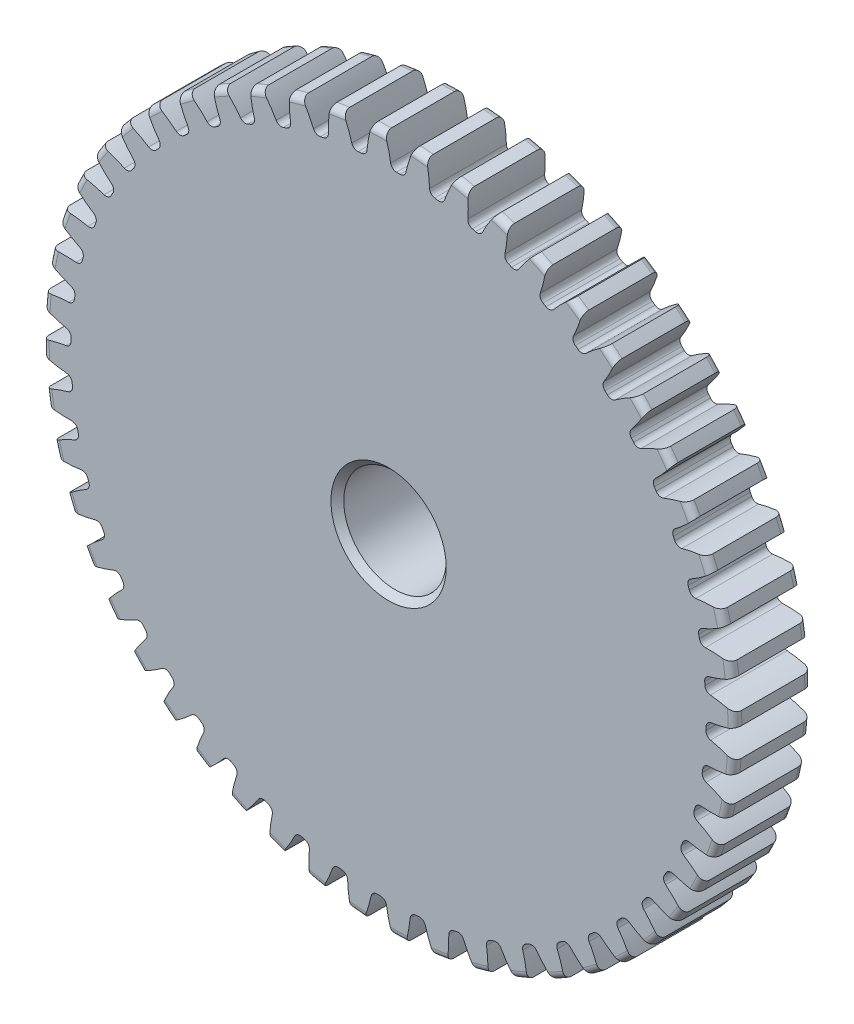
from build123d import *
from OCP.BRepAlgoAPI import BRepAlgoAPI_Cut
from OCP.TopTools import TopTools_ListOfShape

# Parameters (mm, degrees)
SKETCH1_R           = 21.463
BOSS_EXTRUDE1_DEPTH = 4.7625
FILLET2_R           = 0.4292599999999999
CUT_EXTRUDE1_DEPTH  = 33.323496075495925
FILLET1_R           = 0.37404675
CIRPATTERN1_START   = -6
CIRPATTERN1_DEPTH   = 7
SKETCH5_R           = 3.175
CUT_EXTRUDE2_DEPTH  = 33.32153128793448
CHAMFER1_SIZE       = 0.396875


with BuildPart() as part:
    # Sketch1 → Boss-Extrude1 (new body)
    with BuildSketch(Plane.XY):
        Circle(SKETCH1_R)
    extrude(amount=-BOSS_EXTRUDE1_DEPTH)

    # Sketch2 → Revolve1 (revolve)
    with BuildSketch(Plane(origin=(0, 0, 0), x_dir=(0, 0, -1), z_dir=(1, 0, 0)), mode=Mode.PRIVATE) as revolve1_sk:
        Polygon((4.7625, 0), (11.112499999999999, 0), (11.1125, 7.9375), (4.7625, 7.9375), align=None)
    revolve(revolve1_sk.sketch.rotate(Axis((0, 0, -4.7625), (0, 0, -1)), 90), axis=Axis((0, 0, -4.7625), (0, 0, -1)))

    # Fillet2
    fillet2_edges = [part.edges().sort_by_distance(p)[0] for p in [
        (-21.463, 1.216e-14, 0),
        (-21.463, 1.216e-14, -4.7625),
        (-7.9375, -1.85e-15, -4.7625),
    ]]
    fillet(fillet2_edges, radius=FILLET2_R)

    # Sketch4 → Cut-Extrude1 (cut, through all)
    with BuildSketch(Plane.XY):
        with BuildLine():
            Line((0.12990537501521288, 19.979724619476762), (0.1299053750152129, 19.676633686239324))
            ThreePointArc((0.1299053750152129, 19.676633686239324), (0.594308255052561, 19.668085476906043), (1.0583799824959919, 19.648578076836955))
            Line((1.0583799824959919, 19.648578076836955), (1.076680200368878, 19.951116034515902))
            add(Edge.make_bspline(
                [(3.5053262041691093, 24.1009305435634), (1.5855896955468263, 22.317663113100682), (1.076680200368878, 19.951116034515902)],
                knots=[0, 0, 0, 1, 1, 1], degree=2))
            ThreePointArc((3.5053262041691093, 24.1009305435634), (0.7355816668546032, 24.343399197209276), (-2.0437495252820064, 24.268606320537067))
            add(Edge.make_bspline(
                [(-2.0437495252820064, 24.268606320537067), (-0.23518674762945802, 22.372681303460688), (0.12990537501521288, 19.979724619476762)],
                knots=[0, 0, 0, 1, 1, 1], degree=2))
        make_face()
    extrude(amount=-CUT_EXTRUDE1_DEPTH, mode=Mode.SUBTRACT)

    # Fillet1
    # the kernel refuses this fillet: 0.37404675 mm, written as the material it adds along each edge
    with BuildSketch(Plane(origin=(1.0583799824959916, 19.648578076836955, 0), x_dir=(0.06037863844127482, 0.9981755456932301, 0), z_dir=(0, 0, -1))) as fillet1_piece_1:
        with BuildLine():
            CenterArc((0.3682846750210924, -0.3683215269541162), FILLET1_R, 100.0375195144979, 78.53865716127846)
            Line((-0.005646586015991, -0.35902727040611954), (-0.01312521123673288, -0.3588413852751596))
            ThreePointArc((-0.01312521123673288, -0.3588413852751596), (-0.00948433414538891, -0.1794088739639045), (-0.00748077197120016, 4.938814757435e-05))
            Line((-0.00748077197120016, 4.938814757435e-05), (-3.45e-15, 0.00748093500000005))
            ThreePointArc((-3.45e-15, 0.00748093500000005), (0.15154546661873697, 0.00748093500005724), (0.3017870584017921, 0.00736643053908231))
            Line((0.3017870584017921, 0.00736643053908231), (0.3030909332374632, 0))
        make_face()
    extrude(amount=4.7625)
    with BuildSketch(Plane(origin=(0.12990537501521293, 19.676633686239327, 0), x_dir=(3.7234e-13, 1, 0), z_dir=(0, 0, -1))) as fillet1_piece_2:
        with BuildLine():
            CenterArc((0.36828467502108214, 0.3683215269541169), FILLET1_R, 181.42382332422375, 78.53865716127888)
            Line((-0.0056465860160002, 0.35902727040611954), (-0.01312521123674199, 0.3588413852751596))
            ThreePointArc((-0.01312521123674199, 0.3588413852751596), (-0.00948433414539521, 0.17940887396390423), (-0.00748077197119914, -4.938814757451e-05))
            Line((-0.00748077197119914, -4.938814757451e-05), (-2.79e-15, -0.00748093499999999))
            ThreePointArc((-2.79e-15, -0.00748093499999999), (0.15154546661872537, -0.00748093500005648), (0.30178705840178294, -0.00736643053908234))
            Line((0.30178705840178294, -0.00736643053908234), (0.3030909332374563, 0))
        make_face()
    extrude(amount=4.7625)


with BuildPart() as cirpattern1_tool:
    # CirPattern1: read off the stored shape, not the designer's step
    # CirPattern1 outline → CirPattern1 (new body)
    with BuildSketch(Plane.XY.offset(CIRPATTERN1_START)):
        with BuildLine():
            ThreePointArc((-1.675742488, 19.605577669), (-1.447036982, 19.709901289), (-1.336011305, 19.935429393))
            add(Edge.make_bspline(
                [(-1.336011305, 19.935429393), (-1.265570128742731, 20.70748280821275), (-1.044260141, 21.437587002)],
                knots=[0, 0, 0, 0.3202697880965031, 0.3202697880965031, 0.3202697880965031], degree=2))
            ThreePointArc((-1.044260141, 21.437587002), (-1.942375862, 21.374927954), (-2.837074228, 21.274665188))
            add(Edge.make_bspline(
                [(-2.837074228, 21.274665188), (-2.4877852145535964, 20.596418055803802), (-2.279331459, 19.849708294)],
                knots=[0.6797302119034978, 0.6797302119034978, 0.6797302119034978, 1, 1, 1], degree=2))
            ThreePointArc((-2.279331459, 19.849708294), (-2.129471844, 19.647887279), (-1.885707706, 19.586497775))
            ThreePointArc((-1.885707706, 19.586497775), (-1.780750651, 19.596318934), (-1.675742488, 19.605577669))
        make_face()
        with BuildLine():
            add(Edge.make_bspline(
                [(3.473671284, 19.675870479), (3.7268300430887593, 20.40863174818746), (4.116434535, 21.064557495)],
                knots=[0, 0, 0, 0.32026978809651097, 0.32026978809651097, 0.32026978809651097], degree=2))
            ThreePointArc((4.116434535, 21.064557495), (3.229421133, 21.218652363), (2.336726625, 21.335418385))
            add(Edge.make_bspline(
                [(2.336726625, 21.335418385), (2.5135507713843275, 20.593289550794587), (2.537247897, 19.818391569)],
                knots=[0.6797302119035005, 0.6797302119035005, 0.6797302119035005, 1, 1, 1], degree=2))
            ThreePointArc((2.537247897, 19.818391569), (2.634453932, 19.586571352), (2.856443258, 19.468629139))
            ThreePointArc((2.856443258, 19.468629139), (2.960700809, 19.453047045), (3.064873386, 19.436906641))
            ThreePointArc((3.064873386, 19.436906641), (3.311899403, 19.483465995), (3.473671284, 19.675870479))
        make_face()
        with BuildLine():
            add(Edge.make_bspline(
                [(5.820008418, 19.113706425), (6.159645975509347, 19.810610123355232), (6.625472924, 20.414791801)],
                knots=[0, 0, 0, 0.32026978809650025, 0.32026978809650025, 0.32026978809650025], degree=2))
            ThreePointArc((6.625472924, 20.414791801), (5.763500932, 20.674680794), (4.891389761, 20.898197892))
            add(Edge.make_bspline(
                [(4.891389761, 20.898197892), (4.977470914238654, 20.140166218308664), (4.907591631, 19.368061743)],
                knots=[0.679730211903499, 0.679730211903499, 0.679730211903499, 1, 1, 1], degree=2))
            ThreePointArc((4.907591631, 19.368061743), (4.976146085, 19.126214863), (5.182300496, 18.982374725))
            ThreePointArc((5.182300496, 18.982374725), (5.283919678, 18.954339383), (5.38538721, 18.925760044))
            ThreePointArc((5.38538721, 18.925760044), (5.636224239, 18.942204232), (5.820008418, 19.113706425))
        make_face()
        with BuildLine():
            add(Edge.make_bspline(
                [(8.081476723, 18.272821491), (8.502640399292238, 18.92370519331555), (9.037896999, 19.467332472)],
                knots=[0, 0, 0, 0.32026978809650697, 0.32026978809650697, 0.32026978809650697], degree=2))
            ThreePointArc((9.037896999, 19.467332472), (8.213535909, 19.829225824), (7.374725419, 20.156234616))
            add(Edge.make_bspline(
                [(7.374725419, 20.156234616), (7.368808322875012, 19.393353910655094), (7.206371627, 18.635301963)],
                knots=[0.6797302119034843, 0.6797302119034843, 0.6797302119034843, 1, 1, 1], degree=2))
            ThreePointArc((7.206371627, 18.635301963), (7.245274823, 18.386955093), (7.432588124, 18.219314543))
            ThreePointArc((7.432588124, 18.219314543), (7.530087101, 18.179234772), (7.62736996, 18.138633248))
            ThreePointArc((7.62736996, 18.138633248), (7.878360232, 18.124722478), (8.081476723, 18.272821491))
        make_face()
        with BuildLine():
            add(Edge.make_bspline(
                [(10.2250989, 17.165477673), (10.721647179774678, 17.76085002908428), (11.318528183, 18.235995599)],
                knots=[0, 0, 0, 0.3202697880965031, 0.3202697880965031, 0.3202697880965031], degree=2))
            ThreePointArc((11.318528183, 18.235995599), (10.543799037, 18.69461609), (9.750520974, 19.120348052))
            add(Edge.make_bspline(
                [(9.750520974, 19.120348052), (9.652691913052553, 18.363742832954337), (9.400066499, 17.630797517)],
                knots=[0.6797302119035021, 0.6797302119035021, 0.6797302119035021, 1, 1, 1], degree=2))
            ThreePointArc((9.400066499, 17.630797517), (9.408751139, 17.379572114), (9.574491879, 17.190575729))
            ThreePointArc((9.574491879, 17.190575729), (9.666448896, 17.139035981), (9.758128482, 17.087004336))
            ThreePointArc((9.758128482, 17.087004336), (10.005611994, 17.042941456), (10.2250989, 17.165477673))
        make_face()
        with BuildLine():
            add(Edge.make_bspline(
                [(12.219616111, 15.807822538), (12.784308201329196, 16.339001677477754), (13.43410974, 16.738736847)],
                knots=[0, 0, 0, 0.3202697880965035, 0.3202697880965035, 0.3202697880965035], degree=2))
            ThreePointArc((13.43410974, 16.738736847), (12.720309832, 17.287396757), (11.984131977, 17.805643757))
            add(Edge.make_bspline(
                [(11.984131977, 17.805643757), (11.795817519168615, 17.066347033201566), (11.456687233, 16.369196343)],
                knots=[0.6797302119035071, 0.6797302119035071, 0.6797302119035071, 1, 1, 1], degree=2))
            ThreePointArc((11.456687233, 16.369196343), (11.435026677, 16.118755837), (11.576777984, 15.91115961))
            ThreePointArc((11.576777984, 15.91115961), (11.6618521, 15.848911452), (11.746591517, 15.786208423))
            ThreePointArc((11.746591517, 15.786208423), (11.986959403, 15.71263597), (12.219616111, 15.807822538))
        make_face()
        with BuildLine():
            add(Edge.make_bspline(
                [(14.035943802, 14.219653753), (14.660545221553349, 14.678893889186005), (15.353791726, 14.997389619)],
                knots=[0, 0, 0, 0.32026978809650325, 0.32026978809650325, 0.32026978809650325], degree=2))
            ThreePointArc((15.353791726, 14.997389619), (14.711329867, 15.628088251), (14.04298735, 16.231293082))
            add(Edge.make_bspline(
                [(14.04298735, 16.231293082), (13.76693354398736, 15.52008546363799), (13.34624367, 14.868895426)],
                knots=[0.6797302119035039, 0.6797302119035039, 0.6797302119035039, 1, 1, 1], degree=2))
            ThreePointArc((13.34624367, 14.868895426), (13.294553776, 14.622891805), (13.410248596, 14.399722956))
            ThreePointArc((13.410248596, 14.399722956), (13.487199241, 14.327674106), (13.563762796, 14.255214044))
            ThreePointArc((13.563762796, 14.255214044), (13.79350995, 14.15320487), (14.035943802, 14.219653753))
        make_face()
        with BuildLine():
            add(Edge.make_bspline(
                [(15.647595826, 12.424130397), (16.32299847977445, 12.804734773999566), (17.049580854, 13.037346679)],
                knots=[0, 0, 0, 0.32026978809651946, 0.32026978809651946, 0.32026978809651946], degree=2))
            ThreePointArc((17.049580854, 13.037346679), (16.487825585, 13.740887027), (15.897064346, 14.420253604))
            add(Edge.make_bspline(
                [(15.897064346, 14.420253604), (15.537296677300244, 13.747506099825777), (15.041181821, 13.151772531)],
                knots=[0.6797302119034971, 0.6797302119034971, 0.6797302119034971, 1, 1, 1], degree=2))
            ThreePointArc((15.041181821, 13.151772531), (14.960216345, 12.913793082), (15.048167587, 12.678305916))
            ThreePointArc((15.048167587, 12.678305916), (15.115872645, 12.597507007), (15.183143871, 12.516346545))
            ThreePointArc((15.183143871, 12.516346545), (15.398920062, 12.387388173), (15.647595826, 12.424130397))
        make_face()
        with BuildLine():
            add(Edge.make_bspline(
                [(17.031070668, 10.447435244), (17.747425663968958, 10.743853792056584), (18.496748702, 10.887189867)],
                knots=[0, 0, 0, 0.3202697880964952, 0.3202697880964952, 0.3202697880964952], degree=2))
            ThreePointArc((18.496748702, 10.887189867), (18.023891678, 11.653312729), (17.519326345, 12.398934357))
            add(Edge.make_bspline(
                [(17.519326345, 12.398934357), (17.081091038112945, 11.774457140390318), (16.516785671, 11.242867178)],
                knots=[0.6797302119035021, 0.6797302119035021, 0.6797302119035021, 1, 1, 1], degree=2))
            ThreePointArc((16.516785671, 11.242867178), (16.407725271, 11.016382177), (16.466650409, 10.772010626))
            ThreePointArc((16.466650409, 10.772010626), (16.524122589, 10.68363989), (16.581120519, 10.594962528))
            ThreePointArc((16.581120519, 10.594962528), (16.779779245, 10.440935462), (17.031070668, 10.447435244))
        make_face()
        with BuildLine():
            add(Edge.make_bspline(
                [(18.166194149, 8.318392958), (18.91305541826059, 8.526303228773687), (19.674192302, 8.578273311)],
                knots=[0, 0, 0, 0.3202697880965082, 0.3202697880965082, 0.3202697880965082], degree=2))
            ThreePointArc((19.674192302, 8.578273311), (19.297128845, 9.395806891), (18.886117117, 10.196810728))
            add(Edge.make_bspline(
                [(18.886117117, 10.196810728), (18.375804628322744, 9.629710082079612), (17.751537593, 9.170015505)],
                knots=[0.6797302119034963, 0.6797302119034963, 0.6797302119034963, 1, 1, 1], degree=2))
            ThreePointArc((17.751537593, 9.170015505), (17.615972617, 8.958327612), (17.645012388, 8.708635165))
            ThreePointArc((17.645012388, 8.708635165), (17.691413616, 8.613981245), (17.737307092, 8.5190801))
            ThreePointArc((17.737307092, 8.5190801), (17.915951462, 8.342230402), (18.166194149, 8.318392958))
        make_face()
        with BuildLine():
            add(Edge.make_bspline(
                [(19.036413613, 6.068049772), (19.802890236062225, 6.184419964852429), (20.564741876, 6.144266213)],
                knots=[0, 0, 0, 0.32026978809650397, 0.32026978809650397, 0.32026978809650397], degree=2))
            ThreePointArc((20.564741876, 6.144266213), (20.288970419, 7.00128903), (19.977505773, 7.845994637))
            add(Edge.make_bspline(
                [(19.977505773, 7.845994637), (19.402557608343145, 7.3445401665535), (18.727432124, 6.963444356)],
                knots=[0.6797302119034935, 0.6797302119034935, 0.6797302119034935, 1, 1, 1], degree=2))
            ThreePointArc((18.727432124, 6.963444356), (18.567339414, 6.769640459), (18.566070354, 6.518268194))
            ThreePointArc((18.566070354, 6.518268194), (18.600723995, 6.418711357), (18.634843787, 6.318970301))
            ThreePointArc((18.634843787, 6.318970301), (18.790868762, 6.121876837), (19.036413613, 6.068049772))
        make_face()
        with BuildLine():
            add(Edge.make_bspline(
                [(19.6290393, 3.729220757), (20.403954321996714, 3.7523539317426877), (21.155411206, 3.620661879)],
                knots=[0, 0, 0, 0.3202697880965103, 0.3202697880965103, 0.3202697880965103], degree=2))
            ThreePointArc((21.155411206, 3.620661879), (20.984953119, 4.50467661), (20.77757741, 5.380766276))
            add(Edge.make_bspline(
                [(20.77757741, 5.380766276), (20.1463776076792, 4.95227031693491), (19.430238525, 4.655330509)],
                knots=[0.6797302119034873, 0.6797302119034873, 0.6797302119034873, 1, 1, 1], degree=2))
            ThreePointArc((19.430238525, 4.655330509), (19.247952592, 4.482236704), (19.216393206, 4.232850194))
            ThreePointArc((19.216393206, 4.232850194), (19.238793933, 4.129842204), (19.260642497, 4.026715686))
            ThreePointArc((19.260642497, 4.026715686), (19.391772883, 3.812252522), (19.6290393, 3.729220757))
        make_face()
        with BuildLine():
            add(Edge.make_bspline(
                [(19.935429393, 1.336011305), (20.707482808212745, 1.2655701287429508), (21.437587002, 1.044260141)],
                knots=[0, 0, 0, 0.3202697880965029, 0.3202697880965029, 0.3202697880965029], degree=2))
            ThreePointArc((21.437587002, 1.044260141), (21.374927948, 1.942375862), (21.274665181, 2.837074227))
            add(Edge.make_bspline(
                [(21.274665181, 2.837074227), (20.596418055803795, 2.487785214553814), (19.849708294, 2.279331459)],
                knots=[0.6797302119035008, 0.6797302119035008, 0.6797302119035008, 1, 1, 1], degree=2))
            ThreePointArc((19.849708294, 2.279331459), (19.647887279, 2.129471844), (19.586497775, 1.885707706))
            ThreePointArc((19.586497775, 1.885707706), (19.596318934, 1.780750651), (19.605577669, 1.675742488))
            ThreePointArc((19.605577669, 1.675742488), (19.709901289, 1.447036982), (19.935429393, 1.336011305))
        make_face()
        with BuildLine():
            add(Edge.make_bspline(
                [(19.951116035, -1.0766802), (20.709049565894638, -1.2396685365495985), (21.407154507, -1.547369261)],
                knots=[0, 0, 0, 0.32026978809649875, 0.32026978809649875, 0.32026978809649875], degree=2))
            ThreePointArc((21.407154507, -1.547369261), (21.453208195, -0.648249101), (21.461520428, 0.252011247))
            add(Edge.make_bspline(
                [(21.461520428, 0.252011247), (20.7461163495804, -0.0129773982598896), (19.979724619, -0.129905375)],
                knots=[0.6797302119035104, 0.6797302119035104, 0.6797302119035104, 1, 1, 1], degree=2))
            ThreePointArc((19.979724619, -0.129905375), (19.761311526, -0.254345509), (19.6709871, -0.488932645))
            ThreePointArc((19.6709871, -0.488932645), (19.668085477, -0.594308255), (19.664619371, -0.699666808))
            ThreePointArc((19.664619371, -0.699666808), (19.740614951, -0.939279617), (19.951116035, -1.0766802))
        make_face()
        with BuildLine():
            add(Edge.make_bspline(
                [(19.675870479, -3.473671284), (20.4086317481874, -3.726830043088835), (21.064557495, -4.116434535)],
                knots=[0, 0, 0, 0.32026978809651363, 0.32026978809651363, 0.32026978809651363], degree=2))
            ThreePointArc((21.064557495, -4.116434535), (21.218652358, -3.229421132), (21.33541838, -2.336726624))
            add(Edge.make_bspline(
                [(21.33541838, -2.336726624), (20.593289550794587, -2.513550771384401), (19.818391569, -2.537247897)],
                knots=[0.6797302119034996, 0.6797302119034996, 0.6797302119034996, 1, 1, 1], degree=2))
            ThreePointArc((19.818391569, -2.537247897), (19.586571352, -2.634453932), (19.468629139, -2.856443258))
            ThreePointArc((19.468629139, -2.856443258), (19.453047045, -2.960700809), (19.436906641, -3.064873386))
            ThreePointArc((19.436906641, -3.064873386), (19.483465995, -3.311899403), (19.675870479, -3.473671284))
        make_face()
        with BuildLine():
            add(Edge.make_bspline(
                [(19.113706425, -5.820008418), (19.810610123355175, -6.159645975509417), (20.414791801, -6.625472924)],
                knots=[0, 0, 0, 0.3202697880965059, 0.3202697880965059, 0.3202697880965059], degree=2))
            ThreePointArc((20.414791801, -6.625472924), (20.67468079, -5.763500931), (20.898197888, -4.89138976))
            add(Edge.make_bspline(
                [(20.898197888, -4.89138976), (20.140166218308647, -4.977470914238726), (19.368061743, -4.907591631)],
                knots=[0.6797302119035046, 0.6797302119035046, 0.6797302119035046, 1, 1, 1], degree=2))
            ThreePointArc((19.368061743, -4.907591631), (19.126214863, -4.976146085), (18.982374725, -5.182300496))
            ThreePointArc((18.982374725, -5.182300496), (18.954339383, -5.283919678), (18.925760044, -5.38538721))
            ThreePointArc((18.925760044, -5.38538721), (18.942204232, -5.636224239), (19.113706425, -5.820008418))
        make_face()
        with BuildLine():
            add(Edge.make_bspline(
                [(18.272821491, -8.081476723), (18.92370519331547, -8.502640399292302), (19.467332472, -9.037896999)],
                knots=[0, 0, 0, 0.32026978809650236, 0.32026978809650236, 0.32026978809650236], degree=2))
            ThreePointArc((19.467332472, -9.037896999), (19.829225821, -8.213535908), (20.156234613, -7.374725418))
            add(Edge.make_bspline(
                [(20.156234613, -7.374725418), (19.393353910655044, -7.368808322875064), (18.635301963, -7.206371627)],
                knots=[0.679730211903505, 0.679730211903505, 0.679730211903505, 1, 1, 1], degree=2))
            ThreePointArc((18.635301963, -7.206371627), (18.386955093, -7.245274823), (18.219314543, -7.432588124))
            ThreePointArc((18.219314543, -7.432588124), (18.179234772, -7.530087101), (18.138633248, -7.62736996))
            ThreePointArc((18.138633248, -7.62736996), (18.124722478, -7.878360232), (18.272821491, -8.081476723))
        make_face()
        with BuildLine():
            add(Edge.make_bspline(
                [(17.165477673, -10.2250989), (17.760850029084175, -10.72164717977477), (18.235995599, -11.318528183)],
                knots=[0, 0, 0, 0.3202697880964994, 0.3202697880964994, 0.3202697880964994], degree=2))
            ThreePointArc((18.235995599, -11.318528183), (18.694616088, -10.543799036), (19.120348049, -9.750520973))
            add(Edge.make_bspline(
                [(19.120348049, -9.750520973), (18.363742832954337, -9.652691913052633), (17.630797517, -9.400066499)],
                knots=[0.6797302119035028, 0.6797302119035028, 0.6797302119035028, 1, 1, 1], degree=2))
            ThreePointArc((17.630797517, -9.400066499), (17.379572114, -9.408751139), (17.190575729, -9.574491879))
            ThreePointArc((17.190575729, -9.574491879), (17.139035981, -9.666448896), (17.087004336, -9.758128482))
            ThreePointArc((17.087004336, -9.758128482), (17.042941456, -10.005611994), (17.165477673, -10.2250989))
        make_face()
        with BuildLine():
            add(Edge.make_bspline(
                [(15.807822538, -12.219616111), (16.339001677477647, -12.78430820132926), (16.738736847, -13.43410974)],
                knots=[0, 0, 0, 0.320269788096501, 0.320269788096501, 0.320269788096501], degree=2))
            ThreePointArc((16.738736847, -13.43410974), (17.287396756, -12.720309832), (17.805643756, -11.984131977))
            add(Edge.make_bspline(
                [(17.805643756, -11.984131977), (17.066347033201524, -11.795817519168658), (16.369196343, -11.456687233)],
                knots=[0.6797302119034954, 0.6797302119034954, 0.6797302119034954, 1, 1, 1], degree=2))
            ThreePointArc((16.369196343, -11.456687233), (16.118755837, -11.435026677), (15.91115961, -11.576777984))
            ThreePointArc((15.91115961, -11.576777984), (15.848911452, -11.6618521), (15.786208423, -11.746591517))
            ThreePointArc((15.786208423, -11.746591517), (15.71263597, -11.986959403), (15.807822538, -12.219616111))
        make_face()
        with BuildLine():
            add(Edge.make_bspline(
                [(14.219653753, -14.035943802), (14.67889388918594, -14.660545221553383), (14.997389619, -15.353791726)],
                knots=[0, 0, 0, 0.320269788096504, 0.320269788096504, 0.320269788096504], degree=2))
            ThreePointArc((14.997389619, -15.353791726), (15.628088251, -14.711329867), (16.231293082, -14.04298735))
            add(Edge.make_bspline(
                [(16.231293082, -14.04298735), (15.520085463637987, -13.76693354398741), (14.868895426, -13.34624367)],
                knots=[0.6797302119034904, 0.6797302119034904, 0.6797302119034904, 1, 1, 1], degree=2))
            ThreePointArc((14.868895426, -13.34624367), (14.622891805, -13.294553776), (14.399722956, -13.410248596))
            ThreePointArc((14.399722956, -13.410248596), (14.327674106, -13.487199241), (14.255214044, -13.563762796))
            ThreePointArc((14.255214044, -13.563762796), (14.15320487, -13.79350995), (14.219653753, -14.035943802))
        make_face()
        with BuildLine():
            add(Edge.make_bspline(
                [(12.424130397, -15.647595826), (12.804734773999538, -16.3229984797745), (13.037346679, -17.049580854)],
                knots=[0, 0, 0, 0.32026978809649587, 0.32026978809649587, 0.32026978809649587], degree=2))
            ThreePointArc((13.037346679, -17.049580854), (13.740887028, -16.487825585), (14.420253605, -15.897064346))
            add(Edge.make_bspline(
                [(14.420253605, -15.897064346), (13.747506099825717, -15.53729667730035), (13.151772531, -15.041181821)],
                knots=[0.6797302119034929, 0.6797302119034929, 0.6797302119034929, 1, 1, 1], degree=2))
            ThreePointArc((13.151772531, -15.041181821), (12.913793082, -14.960216345), (12.678305916, -15.048167587))
            ThreePointArc((12.678305916, -15.048167587), (12.597507007, -15.115872645), (12.516346545, -15.183143871))
            ThreePointArc((12.516346545, -15.183143871), (12.387388173, -15.398920062), (12.424130397, -15.647595826))
        make_face()
        with BuildLine():
            add(Edge.make_bspline(
                [(10.447435244, -17.031070668), (10.743853792056557, -17.74742566396897), (10.887189867, -18.496748702)],
                knots=[0, 0, 0, 0.32026978809650136, 0.32026978809650136, 0.32026978809650136], degree=2))
            ThreePointArc((10.887189867, -18.496748702), (11.65331273, -18.02389168), (12.398934358, -17.519326347))
            add(Edge.make_bspline(
                [(12.398934358, -17.519326347), (11.774457140390329, -17.081091038113023), (11.242867178, -16.516785671)],
                knots=[0.6797302119034959, 0.6797302119034959, 0.6797302119034959, 1, 1, 1], degree=2))
            ThreePointArc((11.242867178, -16.516785671), (11.016382177, -16.407725271), (10.772010626, -16.466650409))
            ThreePointArc((10.772010626, -16.466650409), (10.68363989, -16.524122589), (10.594962528, -16.581120519))
            ThreePointArc((10.594962528, -16.581120519), (10.440935462, -16.779779245), (10.447435244, -17.031070668))
        make_face()
        with BuildLine():
            add(Edge.make_bspline(
                [(8.318392958, -18.166194149), (8.526303228773605, -18.913055418260637), (8.578273311, -19.674192302)],
                knots=[0, 0, 0, 0.32026978809650064, 0.32026978809650064, 0.32026978809650064], degree=2))
            ThreePointArc((8.578273311, -19.674192302), (9.395806892, -19.297128847), (10.196810729, -18.886117119))
            add(Edge.make_bspline(
                [(10.196810729, -18.886117119), (9.62971008207954, -18.37580462832279), (9.170015505, -17.751537593)],
                knots=[0.6797302119034893, 0.6797302119034893, 0.6797302119034893, 1, 1, 1], degree=2))
            ThreePointArc((9.170015505, -17.751537593), (8.958327612, -17.615972617), (8.708635165, -17.645012388))
            ThreePointArc((8.708635165, -17.645012388), (8.613981245, -17.691413616), (8.5190801, -17.737307092))
            ThreePointArc((8.5190801, -17.737307092), (8.342230402, -17.915951462), (8.318392958, -18.166194149))
        make_face()
        with BuildLine():
            add(Edge.make_bspline(
                [(6.068049772, -19.036413613), (6.184419964852358, -19.802890236062225), (6.144266213, -20.564741876)],
                knots=[0, 0, 0, 0.32026978809650414, 0.32026978809650414, 0.32026978809650414], degree=2))
            ThreePointArc((6.144266213, -20.564741876), (7.001289031, -20.288970423), (7.845994638, -19.977505777))
            add(Edge.make_bspline(
                [(7.845994638, -19.977505777), (7.344540166553408, -19.402557608343194), (6.963444356, -18.727432124)],
                knots=[0.6797302119035005, 0.6797302119035005, 0.6797302119035005, 1, 1, 1], degree=2))
            ThreePointArc((6.963444356, -18.727432124), (6.769640459, -18.567339414), (6.518268194, -18.566070354))
            ThreePointArc((6.518268194, -18.566070354), (6.418711357, -18.600723995), (6.318970301, -18.634843787))
            ThreePointArc((6.318970301, -18.634843787), (6.121876837, -18.790868762), (6.068049772, -19.036413613))
        make_face()
        with BuildLine():
            add(Edge.make_bspline(
                [(3.729220757, -19.6290393), (3.7523539317426176, -20.403954321996714), (3.620661879, -21.155411206)],
                knots=[0, 0, 0, 0.32026978809651013, 0.32026978809651013, 0.32026978809651013], degree=2))
            ThreePointArc((3.620661879, -21.155411206), (4.504676611, -20.984953123), (5.380766277, -20.777577414))
            add(Edge.make_bspline(
                [(5.380766277, -20.777577414), (4.952270316934823, -20.146377607679263), (4.655330509, -19.430238525)],
                knots=[0.679730211903502, 0.679730211903502, 0.679730211903502, 1, 1, 1], degree=2))
            ThreePointArc((4.655330509, -19.430238525), (4.482236704, -19.247952592), (4.232850194, -19.216393206))
            ThreePointArc((4.232850194, -19.216393206), (4.129842204, -19.238793933), (4.026715686, -19.260642497))
            ThreePointArc((4.026715686, -19.260642497), (3.812252522, -19.391772883), (3.729220757, -19.6290393))
        make_face()
        with BuildLine():
            add(Edge.make_bspline(
                [(1.336011305, -19.935429393), (1.2655701287428773, -20.707482808212745), (1.044260141, -21.437587002)],
                knots=[0, 0, 0, 0.3202697880965033, 0.3202697880965033, 0.3202697880965033], degree=2))
            ThreePointArc((1.044260141, -21.437587002), (1.942375862, -21.374927953), (2.837074228, -21.274665187))
            add(Edge.make_bspline(
                [(2.837074228, -21.274665187), (2.4877852145537416, -20.596418055803795), (2.279331459, -19.849708294)],
                knots=[0.6797302119034998, 0.6797302119034998, 0.6797302119034998, 1, 1, 1], degree=2))
            ThreePointArc((2.279331459, -19.849708294), (2.129471844, -19.647887279), (1.885707706, -19.586497775))
            ThreePointArc((1.885707706, -19.586497775), (1.780750651, -19.596318934), (1.675742488, -19.605577669))
            ThreePointArc((1.675742488, -19.605577669), (1.447036982, -19.709901289), (1.336011305, -19.935429393))
        make_face()
        with BuildLine():
            add(Edge.make_bspline(
                [(-1.0766802, -19.951116035), (-1.2396685365498183, -20.70904956589464), (-1.547369261, -21.407154507)],
                knots=[0, 0, 0, 0.3202697880964991, 0.3202697880964991, 0.3202697880964991], degree=2))
            ThreePointArc((-1.547369261, -21.407154507), (-0.648249101, -21.453208201), (0.252011247, -21.461520434))
            add(Edge.make_bspline(
                [(0.252011247, -21.461520434), (-0.0129773982601071, -20.746116349580397), (-0.129905375, -19.979724619)],
                knots=[0.6797302119035117, 0.6797302119035117, 0.6797302119035117, 1, 1, 1], degree=2))
            ThreePointArc((-0.129905375, -19.979724619), (-0.254345509, -19.761311526), (-0.488932645, -19.6709871))
            ThreePointArc((-0.488932645, -19.6709871), (-0.594308255, -19.668085477), (-0.699666808, -19.664619371))
            ThreePointArc((-0.699666808, -19.664619371), (-0.939279617, -19.740614951), (-1.0766802, -19.951116035))
        make_face()
        with BuildLine():
            add(Edge.make_bspline(
                [(-3.473671284, -19.675870479), (-3.7268300430888983, -20.408631748187375), (-4.116434535, -21.064557495)],
                knots=[0, 0, 0, 0.32026978809650175, 0.32026978809650175, 0.32026978809650175], degree=2))
            ThreePointArc((-4.116434535, -21.064557495), (-3.229421133, -21.218652365), (-2.336726625, -21.335418386))
            add(Edge.make_bspline(
                [(-2.336726625, -21.335418386), (-2.513550771384471, -20.593289550794584), (-2.537247897, -19.818391569)],
                knots=[0.6797302119035008, 0.6797302119035008, 0.6797302119035008, 1, 1, 1], degree=2))
            ThreePointArc((-2.537247897, -19.818391569), (-2.634453932, -19.586571352), (-2.856443258, -19.468629139))
            ThreePointArc((-2.856443258, -19.468629139), (-2.960700809, -19.453047045), (-3.064873386, -19.436906641))
            ThreePointArc((-3.064873386, -19.436906641), (-3.311899403, -19.483465995), (-3.473671284, -19.675870479))
        make_face()
        with BuildLine():
            add(Edge.make_bspline(
                [(-5.820008418, -19.113706425), (-6.159645975509491, -19.810610123355183), (-6.625472924, -20.414791801)],
                knots=[0, 0, 0, 0.3202697880965074, 0.3202697880965074, 0.3202697880965074], degree=2))
            ThreePointArc((-6.625472924, -20.414791801), (-5.763500932, -20.674680797), (-4.891389761, -20.898197895))
            add(Edge.make_bspline(
                [(-4.891389761, -20.898197895), (-4.977470914238798, -20.1401662183086), (-4.907591631, -19.368061743)],
                knots=[0.679730211903495, 0.679730211903495, 0.679730211903495, 1, 1, 1], degree=2))
            ThreePointArc((-4.907591631, -19.368061743), (-4.976146085, -19.126214863), (-5.182300496, -18.982374725))
            ThreePointArc((-5.182300496, -18.982374725), (-5.283919678, -18.954339383), (-5.38538721, -18.925760044))
            ThreePointArc((-5.38538721, -18.925760044), (-5.636224239, -18.942204232), (-5.820008418, -19.113706425))
        make_face()
        with BuildLine():
            add(Edge.make_bspline(
                [(-8.081476723, -18.272821491), (-8.50264039929237, -18.923705193315445), (-9.037896999, -19.467332472)],
                knots=[0, 0, 0, 0.32026978809650614, 0.32026978809650614, 0.32026978809650614], degree=2))
            ThreePointArc((-9.037896999, -19.467332472), (-8.21353591, -19.829225828), (-7.374725421, -20.15623462))
            add(Edge.make_bspline(
                [(-7.374725421, -20.15623462), (-7.3688083228751395, -19.393353910655033), (-7.206371627, -18.635301963)],
                knots=[0.6797302119034964, 0.6797302119034964, 0.6797302119034964, 1, 1, 1], degree=2))
            ThreePointArc((-7.206371627, -18.635301963), (-7.245274823, -18.386955093), (-7.432588124, -18.219314543))
            ThreePointArc((-7.432588124, -18.219314543), (-7.530087101, -18.179234772), (-7.62736996, -18.138633248))
            ThreePointArc((-7.62736996, -18.138633248), (-7.878360232, -18.124722478), (-8.081476723, -18.272821491))
        make_face()
        with BuildLine():
            add(Edge.make_bspline(
                [(-10.2250989, -17.165477673), (-10.721647179774795, -17.760850029084203), (-11.318528183, -18.235995599)],
                knots=[0, 0, 0, 0.32026978809651574, 0.32026978809651574, 0.32026978809651574], degree=2))
            ThreePointArc((-11.318528183, -18.235995599), (-10.54379904, -18.694616095), (-9.750520977, -19.120348056))
            add(Edge.make_bspline(
                [(-9.750520977, -19.120348056), (-9.652691913052706, -18.36374283295429), (-9.400066499, -17.630797517)],
                knots=[0.6797302119034927, 0.6797302119034927, 0.6797302119034927, 1, 1, 1], degree=2))
            ThreePointArc((-9.400066499, -17.630797517), (-9.408751139, -17.379572114), (-9.574491879, -17.190575729))
            ThreePointArc((-9.574491879, -17.190575729), (-9.666448896, -17.139035981), (-9.758128482, -17.087004336))
            ThreePointArc((-9.758128482, -17.087004336), (-10.005611994, -17.042941456), (-10.2250989, -17.165477673))
        make_face()
        with BuildLine():
            add(Edge.make_bspline(
                [(-12.219616111, -15.807822538), (-12.784308201329296, -16.339001677477654), (-13.43410974, -16.738736847)],
                knots=[0, 0, 0, 0.3202697880965039, 0.3202697880965039, 0.3202697880965039], degree=2))
            ThreePointArc((-13.43410974, -16.738736847), (-12.720309837, -17.287396762), (-11.984131981, -17.805643763))
            add(Edge.make_bspline(
                [(-11.984131981, -17.805643763), (-11.79581751916873, -17.066347033201502), (-11.456687233, -16.369196343)],
                knots=[0.6797302119034915, 0.6797302119034915, 0.6797302119034915, 1, 1, 1], degree=2))
            ThreePointArc((-11.456687233, -16.369196343), (-11.435026677, -16.118755837), (-11.576777984, -15.91115961))
            ThreePointArc((-11.576777984, -15.91115961), (-11.6618521, -15.848911452), (-11.746591517, -15.786208423))
            ThreePointArc((-11.746591517, -15.786208423), (-11.986959403, -15.71263597), (-12.219616111, -15.807822538))
        make_face()
        with BuildLine():
            add(Edge.make_bspline(
                [(-14.035943802, -14.219653753), (-14.660545221553452, -14.67889388918591), (-15.353791726, -14.997389619)],
                knots=[0, 0, 0, 0.32026978809650475, 0.32026978809650475, 0.32026978809650475], degree=2))
            ThreePointArc((-15.353791726, -14.997389619), (-14.711329872, -15.628088257), (-14.042987355, -16.231293088))
            add(Edge.make_bspline(
                [(-14.042987355, -16.231293088), (-13.76693354398746, -15.52008546363789), (-13.34624367, -14.868895426)],
                knots=[0.6797302119035035, 0.6797302119035035, 0.6797302119035035, 1, 1, 1], degree=2))
            ThreePointArc((-13.34624367, -14.868895426), (-13.294553776, -14.622891805), (-13.410248596, -14.399722956))
            ThreePointArc((-13.410248596, -14.399722956), (-13.487199241, -14.327674106), (-13.563762796, -14.255214044))
            ThreePointArc((-13.563762796, -14.255214044), (-13.79350995, -14.15320487), (-14.035943802, -14.219653753))
        make_face()
        with BuildLine():
            add(Edge.make_bspline(
                [(-15.647595826, -12.424130397), (-16.32299847977455, -12.804734773999467), (-17.049580854, -13.037346679)],
                knots=[0, 0, 0, 0.32026978809651957, 0.32026978809651957, 0.32026978809651957], degree=2))
            ThreePointArc((-17.049580854, -13.037346679), (-16.487825592, -13.740887033), (-15.897064352, -14.42025361))
            add(Edge.make_bspline(
                [(-15.897064352, -14.42025361), (-15.537296677300342, -13.747506099825676), (-15.041181821, -13.151772531)],
                knots=[0.6797302119034986, 0.6797302119034986, 0.6797302119034986, 1, 1, 1], degree=2))
            ThreePointArc((-15.041181821, -13.151772531), (-14.960216345, -12.913793082), (-15.048167587, -12.678305916))
            ThreePointArc((-15.048167587, -12.678305916), (-15.115872645, -12.597507007), (-15.183143871, -12.516346545))
            ThreePointArc((-15.183143871, -12.516346545), (-15.398920062, -12.387388173), (-15.647595826, -12.424130397))
        make_face()
        with BuildLine():
            add(Edge.make_bspline(
                [(-17.031070668, -10.447435244), (-17.747425663969047, -10.743853792056463), (-18.496748702, -10.887189867)],
                knots=[0, 0, 0, 0.32026978809650625, 0.32026978809650625, 0.32026978809650625], degree=2))
            ThreePointArc((-18.496748702, -10.887189867), (-18.023891686, -11.653312735), (-17.519326353, -12.398934363))
            add(Edge.make_bspline(
                [(-17.519326353, -12.398934363), (-17.081091038113048, -11.774457140390222), (-16.516785671, -11.242867178)],
                knots=[0.6797302119035, 0.6797302119035, 0.6797302119035, 1, 1, 1], degree=2))
            ThreePointArc((-16.516785671, -11.242867178), (-16.407725271, -11.016382177), (-16.466650409, -10.772010626))
            ThreePointArc((-16.466650409, -10.772010626), (-16.524122589, -10.68363989), (-16.581120519, -10.594962528))
            ThreePointArc((-16.581120519, -10.594962528), (-16.779779245, -10.440935462), (-17.031070668, -10.447435244))
        make_face()
        with BuildLine():
            add(Edge.make_bspline(
                [(-18.166194149, -8.318392958), (-18.91305541826068, -8.526303228773545), (-19.674192302, -8.578273311)],
                knots=[0, 0, 0, 0.32026978809650475, 0.32026978809650475, 0.32026978809650475], degree=2))
            ThreePointArc((-19.674192302, -8.578273311), (-19.297128854, -9.395806895), (-18.886117126, -10.196810733))
            add(Edge.make_bspline(
                [(-18.886117126, -10.196810733), (-18.375804628322832, -9.62971008207945), (-17.751537593, -9.170015505)],
                knots=[0.6797302119035024, 0.6797302119035024, 0.6797302119035024, 1, 1, 1], degree=2))
            ThreePointArc((-17.751537593, -9.170015505), (-17.615972617, -8.958327612), (-17.645012388, -8.708635165))
            ThreePointArc((-17.645012388, -8.708635165), (-17.691413616, -8.613981245), (-17.737307092, -8.5190801))
            ThreePointArc((-17.737307092, -8.5190801), (-17.915951462, -8.342230402), (-18.166194149, -8.318392958))
        make_face()
        with BuildLine():
            add(Edge.make_bspline(
                [(-19.036413613, -6.068049772), (-19.80289023606224, -6.184419964852295), (-20.564741876, -6.144266213)],
                knots=[0, 0, 0, 0.3202697880965088, 0.3202697880965088, 0.3202697880965088], degree=2))
            ThreePointArc((-20.564741876, -6.144266213), (-20.28897043, -7.001289034), (-19.977505784, -7.845994641))
            add(Edge.make_bspline(
                [(-19.977505784, -7.845994641), (-19.402557608343233, -7.344540166553348), (-18.727432124, -6.963444356)],
                knots=[0.6797302119034977, 0.6797302119034977, 0.6797302119034977, 1, 1, 1], degree=2))
            ThreePointArc((-18.727432124, -6.963444356), (-18.567339414, -6.769640459), (-18.566070354, -6.518268194))
            ThreePointArc((-18.566070354, -6.518268194), (-18.600723995, -6.418711357), (-18.634843787, -6.318970301))
            ThreePointArc((-18.634843787, -6.318970301), (-18.790868762, -6.121876837), (-19.036413613, -6.068049772))
        make_face()
        with BuildLine():
            add(Edge.make_bspline(
                [(-19.6290393, -3.729220757), (-20.403954321996714, -3.7523539317425447), (-21.155411206, -3.620661879)],
                knots=[0, 0, 0, 0.3202697880965107, 0.3202697880965107, 0.3202697880965107], degree=2))
            ThreePointArc((-21.155411206, -3.620661879), (-20.98495313, -4.504676612), (-20.777577421, -5.380766279))
            add(Edge.make_bspline(
                [(-20.777577421, -5.380766279), (-20.14637760767926, -4.952270316934747), (-19.430238525, -4.655330509)],
                knots=[0.6797302119035048, 0.6797302119035048, 0.6797302119035048, 1, 1, 1], degree=2))
            ThreePointArc((-19.430238525, -4.655330509), (-19.247952592, -4.482236704), (-19.216393206, -4.232850194))
            ThreePointArc((-19.216393206, -4.232850194), (-19.238793933, -4.129842204), (-19.260642497, -4.026715686))
            ThreePointArc((-19.260642497, -4.026715686), (-19.391772883, -3.812252522), (-19.6290393, -3.729220757))
        make_face()
        with BuildLine():
            add(Edge.make_bspline(
                [(-19.935429393, -1.336011305), (-20.707482808212745, -1.2655701287428043), (-21.437587002, -1.044260141)],
                knots=[0, 0, 0, 0.32026978809650286, 0.32026978809650286, 0.32026978809650286], degree=2))
            ThreePointArc((-21.437587002, -1.044260141), (-21.374927959, -1.942375863), (-21.274665193, -2.837074228))
            add(Edge.make_bspline(
                [(-21.274665193, -2.837074228), (-20.596418055803802, -2.4877852145536696), (-19.849708294, -2.279331459)],
                knots=[0.6797302119034978, 0.6797302119034978, 0.6797302119034978, 1, 1, 1], degree=2))
            ThreePointArc((-19.849708294, -2.279331459), (-19.647887279, -2.129471844), (-19.586497775, -1.885707706))
            ThreePointArc((-19.586497775, -1.885707706), (-19.596318934, -1.780750651), (-19.605577669, -1.675742488))
            ThreePointArc((-19.605577669, -1.675742488), (-19.709901289, -1.447036982), (-19.935429393, -1.336011305))
        make_face()
        with BuildLine():
            add(Edge.make_bspline(
                [(-19.951116035, 1.0766802), (-20.70904956589464, 1.239668536549745), (-21.407154507, 1.547369261)],
                knots=[0, 0, 0, 0.3202697880964986, 0.3202697880964986, 0.3202697880964986], degree=2))
            ThreePointArc((-21.407154507, 1.547369261), (-21.453208207, 0.648249101), (-21.46152044, -0.252011247))
            add(Edge.make_bspline(
                [(-21.46152044, -0.252011247), (-20.746116349580397, 0.01297739826003452), (-19.979724619, 0.129905375)],
                knots=[0.6797302119035117, 0.6797302119035117, 0.6797302119035117, 1, 1, 1], degree=2))
            ThreePointArc((-19.979724619, 0.129905375), (-19.761311526, 0.254345509), (-19.6709871, 0.488932645))
            ThreePointArc((-19.6709871, 0.488932645), (-19.668085477, 0.594308255), (-19.664619371, 0.699666808))
            ThreePointArc((-19.664619371, 0.699666808), (-19.740614951, 0.939279617), (-19.951116035, 1.0766802))
        make_face()
        with BuildLine():
            add(Edge.make_bspline(
                [(-19.675870479, 3.473671284), (-20.40863174818737, 3.726830043088968), (-21.064557495, 4.116434535)],
                knots=[0, 0, 0, 0.3202697880965012, 0.3202697880965012, 0.3202697880965012], degree=2))
            ThreePointArc((-21.064557495, 4.116434535), (-21.21865237, 3.229421134), (-21.335418391, 2.336726626))
            add(Edge.make_bspline(
                [(-21.335418391, 2.336726626), (-20.593289550794587, 2.513550771384544), (-19.818391569, 2.537247897)],
                knots=[0.6797302119035, 0.6797302119035, 0.6797302119035, 1, 1, 1], degree=2))
            ThreePointArc((-19.818391569, 2.537247897), (-19.586571352, 2.634453932), (-19.468629139, 2.856443258))
            ThreePointArc((-19.468629139, 2.856443258), (-19.453047045, 2.960700809), (-19.436906641, 3.064873386))
            ThreePointArc((-19.436906641, 3.064873386), (-19.483465995, 3.311899403), (-19.675870479, 3.473671284))
        make_face()
        with BuildLine():
            add(Edge.make_bspline(
                [(-19.113706425, 5.820008418), (-19.810610123355175, 6.1596459755095605), (-20.414791801, 6.625472924)],
                knots=[0, 0, 0, 0.32026978809650636, 0.32026978809650636, 0.32026978809650636], degree=2))
            ThreePointArc((-20.414791801, 6.625472924), (-20.674680801, 5.763500934), (-20.898197899, 4.891389762))
            add(Edge.make_bspline(
                [(-20.898197899, 4.891389762), (-20.1401662183086, 4.977470914238862), (-19.368061743, 4.907591631)],
                knots=[0.6797302119034954, 0.6797302119034954, 0.6797302119034954, 1, 1, 1], degree=2))
            ThreePointArc((-19.368061743, 4.907591631), (-19.126214863, 4.976146085), (-18.982374725, 5.182300496))
            ThreePointArc((-18.982374725, 5.182300496), (-18.954339383, 5.283919678), (-18.925760044, 5.38538721))
            ThreePointArc((-18.925760044, 5.38538721), (-18.942204232, 5.636224239), (-19.113706425, 5.820008418))
        make_face()
        with BuildLine():
            add(Edge.make_bspline(
                [(-18.272821491, 8.081476723), (-18.923705193315445, 8.502640399292433), (-19.467332472, 9.037896999)],
                knots=[0, 0, 0, 0.3202697880965067, 0.3202697880965067, 0.3202697880965067], degree=2))
            ThreePointArc((-19.467332472, 9.037896999), (-19.829225831, 8.213535912), (-20.156234623, 7.374725422))
            add(Edge.make_bspline(
                [(-20.156234623, 7.374725422), (-19.393353910655033, 7.368808322875202), (-18.635301963, 7.206371627)],
                knots=[0.6797302119034963, 0.6797302119034963, 0.6797302119034963, 1, 1, 1], degree=2))
            ThreePointArc((-18.635301963, 7.206371627), (-18.386955093, 7.245274823), (-18.219314543, 7.432588124))
            ThreePointArc((-18.219314543, 7.432588124), (-18.179234772, 7.530087101), (-18.138633248, 7.62736996))
            ThreePointArc((-18.138633248, 7.62736996), (-18.124722478, 7.878360232), (-18.272821491, 8.081476723))
        make_face()
        with BuildLine():
            add(Edge.make_bspline(
                [(-17.165477673, 10.2250989), (-17.76085002908418, 10.721647179774875), (-18.235995599, 11.318528183)],
                knots=[0, 0, 0, 0.3202697880965015, 0.3202697880965015, 0.3202697880965015], degree=2))
            ThreePointArc((-18.235995599, 11.318528183), (-18.694616097, 10.543799041), (-19.120348059, 9.750520978))
            add(Edge.make_bspline(
                [(-19.120348059, 9.750520978), (-18.363742832954237, 9.652691913052747), (-17.630797517, 9.400066499)],
                knots=[0.6797302119035012, 0.6797302119035012, 0.6797302119035012, 1, 1, 1], degree=2))
            ThreePointArc((-17.630797517, 9.400066499), (-17.379572114, 9.408751139), (-17.190575729, 9.574491879))
            ThreePointArc((-17.190575729, 9.574491879), (-17.139035981, 9.666448896), (-17.087004336, 9.758128482))
            ThreePointArc((-17.087004336, 9.758128482), (-17.042941456, 10.005611994), (-17.165477673, 10.2250989))
        make_face()
        with BuildLine():
            add(Edge.make_bspline(
                [(-15.807822538, 12.219616111), (-16.33900167747756, 12.784308201329374), (-16.738736847, 13.43410974)],
                knots=[0, 0, 0, 0.32026978809650913, 0.32026978809650913, 0.32026978809650913], degree=2))
            ThreePointArc((-16.738736847, 13.43410974), (-17.287396763, 12.720309837), (-17.805643764, 11.984131982))
            add(Edge.make_bspline(
                [(-17.805643764, 11.984131982), (-17.06634703320142, 11.795817519168825), (-16.369196343, 11.456687233)],
                knots=[0.6797302119034982, 0.6797302119034982, 0.6797302119034982, 1, 1, 1], degree=2))
            ThreePointArc((-16.369196343, 11.456687233), (-16.118755837, 11.435026677), (-15.91115961, 11.576777984))
            ThreePointArc((-15.91115961, 11.576777984), (-15.848911452, 11.6618521), (-15.786208423, 11.746591517))
            ThreePointArc((-15.786208423, 11.746591517), (-15.71263597, 11.986959403), (-15.807822538, 12.219616111))
        make_face()
        with BuildLine():
            add(Edge.make_bspline(
                [(-14.219653753, 14.035943802), (-14.67889388918584, 14.660545221553482), (-14.997389619, 15.353791726)],
                knots=[0, 0, 0, 0.32026978809650414, 0.32026978809650414, 0.32026978809650414], degree=2))
            ThreePointArc((-14.997389619, 15.353791726), (-15.628088257, 14.711329872), (-16.231293088, 14.042987356))
            add(Edge.make_bspline(
                [(-16.231293088, 14.042987356), (-15.520085463637884, 13.76693354398751), (-14.868895426, 13.34624367)],
                knots=[0.6797302119034906, 0.6797302119034906, 0.6797302119034906, 1, 1, 1], degree=2))
            ThreePointArc((-14.868895426, 13.34624367), (-14.622891805, 13.294553776), (-14.399722956, 13.410248596))
            ThreePointArc((-14.399722956, 13.410248596), (-14.327674106, 13.487199241), (-14.255214044, 13.563762796))
            ThreePointArc((-14.255214044, 13.563762796), (-14.15320487, 13.79350995), (-14.219653753, 14.035943802))
        make_face()
        with BuildLine():
            add(Edge.make_bspline(
                [(-12.424130397, 15.647595826), (-12.804734773999375, 16.322998479774608), (-13.037346679, 17.049580854)],
                knots=[0, 0, 0, 0.3202697880964993, 0.3202697880964993, 0.3202697880964993], degree=2))
            ThreePointArc((-13.037346679, 17.049580854), (-13.740887033, 16.487825591), (-14.42025361, 15.897064352))
            add(Edge.make_bspline(
                [(-14.42025361, 15.897064352), (-13.747506099825618, 15.53729667730045), (-13.151772531, 15.041181821)],
                knots=[0.6797302119034934, 0.6797302119034934, 0.6797302119034934, 1, 1, 1], degree=2))
            ThreePointArc((-13.151772531, 15.041181821), (-12.913793082, 14.960216345), (-12.678305916, 15.048167587))
            ThreePointArc((-12.678305916, 15.048167587), (-12.597507007, 15.115872645), (-12.516346545, 15.183143871))
            ThreePointArc((-12.516346545, 15.183143871), (-12.387388173, 15.398920062), (-12.424130397, 15.647595826))
        make_face()
        with BuildLine():
            add(Edge.make_bspline(
                [(-10.447435244, 17.031070668), (-10.743853792056454, 17.747425663969064), (-10.887189867, 18.496748702)],
                knots=[0, 0, 0, 0.3202697880964985, 0.3202697880964985, 0.3202697880964985], degree=2))
            ThreePointArc((-10.887189867, 18.496748702), (-11.653312734, 18.023891685), (-12.398934362, 17.519326352))
            add(Edge.make_bspline(
                [(-12.398934362, 17.519326352), (-11.774457140390146, 17.081091038113144), (-11.242867178, 16.516785671)],
                knots=[0.6797302119034858, 0.6797302119034858, 0.6797302119034858, 1, 1, 1], degree=2))
            ThreePointArc((-11.242867178, 16.516785671), (-11.016382177, 16.407725271), (-10.772010626, 16.466650409))
            ThreePointArc((-10.772010626, 16.466650409), (-10.68363989, 16.524122589), (-10.594962528, 16.581120519))
            ThreePointArc((-10.594962528, 16.581120519), (-10.440935462, 16.779779245), (-10.447435244, 17.031070668))
        make_face()
        with BuildLine():
            add(Edge.make_bspline(
                [(-8.318392958, 18.166194149), (-8.526303228773477, 18.91305541826069), (-8.578273311, 19.674192302)],
                knots=[0, 0, 0, 0.3202697880965091, 0.3202697880965091, 0.3202697880965091], degree=2))
            ThreePointArc((-8.578273311, 19.674192302), (-9.395806894, 19.297128852), (-10.196810732, 18.886117124))
            add(Edge.make_bspline(
                [(-10.196810732, 18.886117124), (-9.6297100820794, 18.37580462832282), (-9.170015505, 17.751537593)],
                knots=[0.6797302119035088, 0.6797302119035088, 0.6797302119035088, 1, 1, 1], degree=2))
            ThreePointArc((-9.170015505, 17.751537593), (-8.958327612, 17.615972617), (-8.708635165, 17.645012388))
            ThreePointArc((-8.708635165, 17.645012388), (-8.613981245, 17.691413616), (-8.5190801, 17.737307092))
            ThreePointArc((-8.5190801, 17.737307092), (-8.342230402, 17.915951462), (-8.318392958, 18.166194149))
        make_face()
        with BuildLine():
            add(Edge.make_bspline(
                [(-6.068049772, 19.036413613), (-6.184419964852218, 19.802890236062247), (-6.144266213, 20.564741876)],
                knots=[0, 0, 0, 0.32026978809649953, 0.32026978809649953, 0.32026978809649953], degree=2))
            ThreePointArc((-6.144266213, 20.564741876), (-7.001289032, 20.288970426), (-7.845994639, 19.977505781))
            add(Edge.make_bspline(
                [(-7.845994639, 19.977505781), (-7.34454016655329, 19.40255760834324), (-6.963444356, 18.727432124)],
                knots=[0.6797302119034936, 0.6797302119034936, 0.6797302119034936, 1, 1, 1], degree=2))
            ThreePointArc((-6.963444356, 18.727432124), (-6.769640459, 18.567339414), (-6.518268194, 18.566070354))
            ThreePointArc((-6.518268194, 18.566070354), (-6.418711357, 18.600723995), (-6.318970301, 18.634843787))
            ThreePointArc((-6.318970301, 18.634843787), (-6.121876837, 18.790868762), (-6.068049772, 19.036413613))
        make_face()
        with BuildLine():
            add(Edge.make_bspline(
                [(-3.729220757, 19.6290393), (-3.752353931742471, 20.403954321996775), (-3.620661879, 21.155411206)],
                knots=[0, 0, 0, 0.3202697880965068, 0.3202697880965068, 0.3202697880965068], degree=2))
            ThreePointArc((-3.620661879, 21.155411206), (-4.504676612, 20.984953125), (-5.380766278, 20.777577417))
            add(Edge.make_bspline(
                [(-5.380766278, 20.777577417), (-4.952270316934675, 20.146377607679256), (-4.655330509, 19.430238525)],
                knots=[0.6797302119035059, 0.6797302119035059, 0.6797302119035059, 1, 1, 1], degree=2))
            ThreePointArc((-4.655330509, 19.430238525), (-4.482236704, 19.247952592), (-4.232850194, 19.216393206))
            ThreePointArc((-4.232850194, 19.216393206), (-4.129842204, 19.238793933), (-4.026715686, 19.260642497))
            ThreePointArc((-4.026715686, 19.260642497), (-3.812252522, 19.391772883), (-3.729220757, 19.6290393))
        make_face()
    extrude(amount=CIRPATTERN1_DEPTH)


with BuildPart() as part_1:
    add(part.part)

    # CirPattern1: cut by cirpattern1_tool, with a tolerance
    cirpattern1_stock = TopTools_ListOfShape()
    cirpattern1_stock.Append(part_1.part.wrapped)
    cirpattern1_tools = TopTools_ListOfShape()
    cirpattern1_tools.Append(cirpattern1_tool.part.wrapped)
    cirpattern1_cut = BRepAlgoAPI_Cut()
    cirpattern1_cut.SetArguments(cirpattern1_stock)
    cirpattern1_cut.SetTools(cirpattern1_tools)
    cirpattern1_cut.SetFuzzyValue(0.00001)
    cirpattern1_cut.Build()
    add(Compound.cast(cirpattern1_cut.Shape()).solids(), mode=Mode.REPLACE)

    # Sketch5 → Cut-Extrude2 (cut, through all)
    with BuildSketch(Plane.XY):
        Circle(SKETCH5_R)
    extrude(amount=-CUT_EXTRUDE2_DEPTH, mode=Mode.SUBTRACT)

    # Chamfer1
    chamfer1_edges = [part_1.edges().sort_by_distance(p)[0] for p in [
        (-3.175, 3.9e-16, -11.112499999999999),
        (-3.175, 3.9e-16, 0),
        (-7.9375, -1.85e-15, -11.1125),
    ]]
    chamfer(chamfer1_edges, length=CHAMFER1_SIZE)


solid = part_1.part
